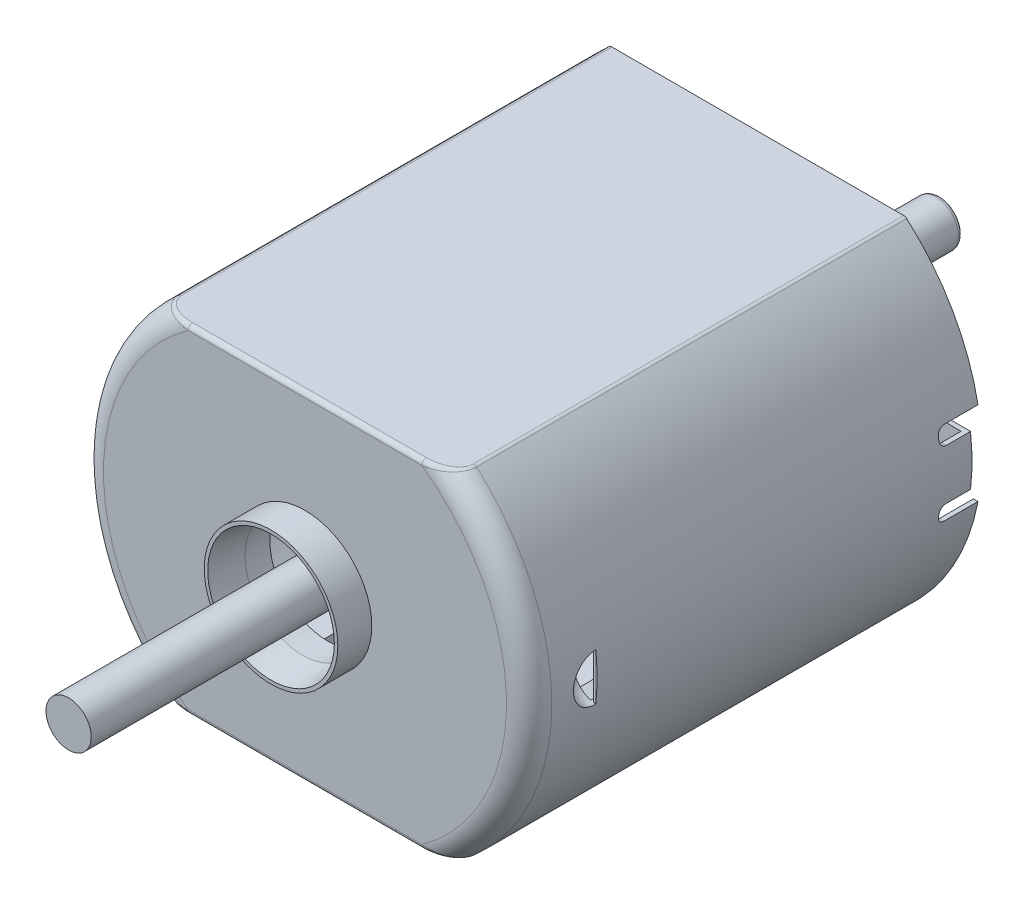
from build123d import *

# Parameters (mm, degrees)
BOSS_EXTRUDE1_DEPTH = 10
FILLET1_R           = 1
FILLET2_R           = 0.2
CUT_EXTRUDE1_DEPTH  = 3.5
BOSS_EXTRUDE2_DEPTH = 0.1
FILLET3_R           = 0.2
SKETCH4_R           = 2.95
SKETCH4_R_2         = 2.55
BOSS_EXTRUDE3_DEPTH = 1.5
CHAMFER1_SIZE       = 1.4
CHAMFER1_SIZE2      = 0.246857773
CUT_EXTRUDE2_DEPTH  = 11.75
CUT_EXTRUDE3_DEPTH  = 5.5
CUT_EXTRUDE4_DEPTH  = 13.5
CUT_EXTRUDE5_START  = -13.5
SKETCH8_R           = 2.55
CUT_EXTRUDE5_DEPTH  = 13.5
SKETCH10_W          = 12.644572441
SKETCH10_H          = 2.219087426
CUT_EXTRUDE6_DEPTH  = 9.625
CUT_REVOLVE1_ANGLE  = 180
CUT_REVOLVE2_ANGLE  = 180
SKETCH15_W          = 1.07108749
SKETCH15_H          = 2.219087426
CUT_EXTRUDE7_DEPTH  = 3.709331572
FILLET4_R           = 0.2
SKETCH16_R          = 1
BOSS_EXTRUDE4_DEPTH = 8.5
FILLET5_R           = 0.2
SKETCH17_R          = 1
BOSS_EXTRUDE5_DEPTH = 30


with BuildPart() as part:
    # Sketch1 → Boss-Extrude1 (new, symmetric)
    with BuildSketch(Plane.XY):
        with BuildLine():
            Line((-6.519777604, -7.45), (6.519777604, -7.45))
            ThreePointArc((6.519777604, -7.45), (9.9, 0), (6.519777604, 7.45))
            Line((6.519777604, 7.45), (-6.519777604, 7.45))
            ThreePointArc((-6.519777604, 7.45), (-9.9, 0), (-6.519777604, -7.45))
        make_face()
    extrude(amount=BOSS_EXTRUDE1_DEPTH, both=True)

    # Fillet1
    fillet1_edges = [part.edges().sort_by_distance(p)[0] for p in [
        (-9.9, 0, 10),
        (9.9, 0, 10),
    ]]
    fillet(fillet1_edges, radius=FILLET1_R)

    # Fillet2
    fillet2_edges = [part.edges().sort_by_distance(p)[0] for p in [
        (0, 7.45, 10),
        (0, -7.45, 10),
        (-6.519777604, 7.45, -0.5),
        (6.519777604, 7.45, -0.5),
        (-5.90343561, 7.45, 9.795904471),
        (5.90343561, 7.45, 9.795904471),
        (6.519777604, -7.45, -0.5),
        (-6.519777604, -7.45, -0.5),
        (-5.90343561, -7.45, 9.795904471),
        (5.90343561, -7.45, 9.795904471),
    ]]
    fillet(fillet2_edges, radius=FILLET2_R)

    # Sketch2 → Cut-Extrude1 (cut, symmetric)
    with BuildSketch(Plane.XY):
        Polygon((2.809004691, -7.45), (4.078019779, -6.905487171), (4.078019779, -6.588233399), (2.70413604, -7.177743586), (2.70413604, -5.101106343), (4.375445191, -5.101106343), (4.375445191, -7.316955751), (4.065378741, -7.45), align=None)
        Polygon((-4.375445191, -7.316955751), (-4.065378741, -7.45), (-2.809004691, -7.45), (-4.078019779, -6.905487171), (-4.078019779, -6.588233399), (-2.70413604, -7.177743586), (-2.70413604, -5.101106343), (-4.375445191, -5.101106343), align=None)
    extrude(amount=CUT_EXTRUDE1_DEPTH, both=True, mode=Mode.SUBTRACT)

    # Sketch3 → Boss-Extrude2 (add)
    with BuildSketch(Plane.XZ.offset(7.45)):
        Polygon((-4.375445191, -3.5), (-4.375445191, 0), (-3.437191716, -3.5), align=None)
        Polygon((3.437191716, -3.5), (4.375445191, 0), (4.375445191, -3.5), align=None)
    extrude(amount=-BOSS_EXTRUDE2_DEPTH)

    # Fillet3
    # the kernel refuses this fillet: 0.2 mm, written as the material it takes off along each edge
    with BuildSketch(Plane(origin=(3.325071696, -7.35, -3.918245264), x_dir=(0, -1, 0), z_dir=(0.2589300963584657, 0, 0.9658960633524685))) as fillet3_piece_1_section:
        with BuildLine():
            CenterArc((0.2, 0.173205081), FILLET3_R, 180, 60)
            Line((0, 0.173205081), (-0.004, 0.173205081))
            Line((-0.004, 0.173205081), (-0.004, 0))
            Line((-0.004, 0), (0, -0.004))
            ThreePointArc((0, -0.004), (0.05, -0.004), (0.098, -0.003464102))
            Line((0.098, -0.003464102), (0.1, 0))
        make_face()
    fillet3_piece_1 = extrude(amount=4.192182419, mode=Mode.PRIVATE)
    fillet3_piece_1 = split(fillet3_piece_1, bisect_by=Plane(origin=(3.476415364, -7.702714186, -3.918245264), z_dir=(-0.3943164502016401, 0.9189747205991999, 0)), keep=Keep.TOP, mode=Mode.PRIVATE)
    fillet3_piece_1 = split(fillet3_piece_1, bisect_by=Plane(origin=(3.325071696, -7.35, -3.5), z_dir=(0, 0, 1)), keep=Keep.TOP, mode=Mode.PRIVATE)
    add(fillet3_piece_1, mode=Mode.SUBTRACT)
    with BuildSketch(Plane(origin=(-4.410553893, -7.35, 0.130967231), x_dir=(0, -1, 0), z_dir=(0.2589300963584657, 0, -0.9658960633524685))) as fillet3_piece_2_section:
        with BuildLine():
            CenterArc((0.2, 0.173205081), FILLET3_R, 180, 60)
            Line((0, 0.173205081), (-0.004, 0.173205081))
            Line((-0.004, 0.173205081), (-0.004, 0))
            Line((-0.004, 0), (0, -0.004))
            ThreePointArc((0, -0.004), (0.05, -0.004), (0.098, -0.003464102))
            Line((0.098, -0.003464102), (0.1, 0))
        make_face()
    fillet3_piece_2 = extrude(amount=4.192182419, mode=Mode.PRIVATE)
    fillet3_piece_2 = split(fillet3_piece_2, bisect_by=Plane(origin=(-4.410553893, -7.35, -3.5), z_dir=(0, 0, 1)), keep=Keep.TOP, mode=Mode.PRIVATE)
    fillet3_piece_2 = split(fillet3_piece_2, bisect_by=Plane(origin=(-4.39312086, -7.309371421, 0.130967231), z_dir=(0.3943164502016401, 0.9189747205991999, 0)), keep=Keep.TOP, mode=Mode.PRIVATE)
    add(fillet3_piece_2, mode=Mode.SUBTRACT)

    # Sketch4 → Boss-Extrude3 (add)
    with BuildSketch(Plane.XY.offset(10)):
        Circle(SKETCH4_R)
        Circle(SKETCH4_R_2, mode=Mode.SUBTRACT)
    extrude(amount=BOSS_EXTRUDE3_DEPTH)

    # Chamfer1
    chamfer1_edges = [part.edges().sort_by_distance(p)[0] for p in [
        (-2.55, 0, 11.5),
    ]]
    chamfer1_side = [part.faces().sort_by_distance(p)[0] for p in [
        (-2.55, 0, 10.75),
    ]]
    chamfer(chamfer1_edges, length=CHAMFER1_SIZE, length2=CHAMFER1_SIZE2, reference=chamfer1_side[0])

    # Sketch5 → Cut-Extrude2 (cut, symmetric)
    with BuildSketch(Plane(origin=(0, 0, 0), x_dir=(0, 0, -1), z_dir=(1, 0, 0))):
        with BuildLine():
            Line((10, -1.85), (10, 1.85))
            Line((10, 1.85), (8.5, 1.85))
            ThreePointArc((8.5, 1.85), (8.287867966, 1.762132034), (8.2, 1.55))
            Line((8.2, 1.55), (8.2, 1.409543713))
            ThreePointArc((8.2, 1.409543713), (8.287867966, 1.197411679), (8.5, 1.109543713))
            Line((8.5, 1.109543713), (9.559222729, 1.109543713))
            Line((9.559222729, 1.109543713), (9.559222729, -1.109543713))
            Line((9.559222729, -1.109543713), (8.5, -1.109543713))
            ThreePointArc((8.5, -1.109543713), (8.287867966, -1.197411679), (8.2, -1.409543713))
            Line((8.2, -1.409543713), (8.2, -1.55))
            ThreePointArc((8.2, -1.55), (8.287867966, -1.762132034), (8.5, -1.85))
            Line((8.5, -1.85), (10, -1.85))
        make_face()
    extrude(amount=CUT_EXTRUDE2_DEPTH, both=True, mode=Mode.SUBTRACT)

    # Sketch6 → Cut-Extrude3 (cut)
    with BuildSketch(Plane(origin=(0, 0, -10), x_dir=(-1, 0, 0), z_dir=(0, 0, -1))):
        with BuildLine():
            Line((-6.444183424, -7.25), (6.444183424, -7.25))
            ThreePointArc((6.444183424, -7.25), (8.606512219, -4.474142088), (9.636332951, -1.109543713))
            Line((9.636332951, -1.109543713), (8.55391251, -1.109543713))
            Line((8.55391251, -1.109543713), (8.55391251, 1.109543713))
            Line((8.55391251, 1.109543713), (9.636332951, 1.109543713))
            ThreePointArc((9.636332951, 1.109543713), (8.606512219, 4.474142088), (6.444183424, 7.25))
            Line((6.444183424, 7.25), (-6.444183424, 7.25))
            ThreePointArc((-6.444183424, 7.25), (-8.606512219, 4.474142088), (-9.636332951, 1.109543713))
            Line((-9.636332951, 1.109543713), (-8.55391251, 1.109543713))
            Line((-8.55391251, 1.109543713), (-8.55391251, -1.109543713))
            Line((-8.55391251, -1.109543713), (-9.636332951, -1.109543713))
            ThreePointArc((-9.636332951, -1.109543713), (-8.606512219, -4.474142088), (-6.444183424, -7.25))
        make_face()
    extrude(amount=-CUT_EXTRUDE3_DEPTH, mode=Mode.SUBTRACT)

    # Sketch7 → Cut-Extrude4 (cut)
    with BuildSketch(Plane(origin=(0, 0, -4.5), x_dir=(-1, 0, 0), z_dir=(0, 0, -1))):
        with BuildLine():
            Line((2.70413604, -7.177743586), (2.70413604, -7.25))
            Line((2.70413604, -7.25), (-2.70413604, -7.25))
            Line((-2.70413604, -7.25), (-2.70413604, -7.177743586))
            Line((-2.70413604, -7.177743586), (-2.70413604, -5.101106343))
            Line((-2.70413604, -5.101106343), (-4.375445191, -5.101106343))
            Line((-4.375445191, -5.101106343), (-4.375445191, -7.25))
            Line((-4.375445191, -7.25), (-6.444183424, -7.25))
            ThreePointArc((-6.444183424, -7.25), (-8.606512219, -4.474142088), (-9.636332951, -1.109543713))
            Line((-9.636332951, -1.109543713), (-8.55391251, -1.109543713))
            Line((-8.55391251, -1.109543713), (-8.55391251, 1.109543713))
            Line((-8.55391251, 1.109543713), (-9.636332951, 1.109543713))
            ThreePointArc((-9.636332951, 1.109543713), (-8.606512219, 4.474142088), (-6.444183424, 7.25))
            Line((-6.444183424, 7.25), (6.444183424, 7.25))
            ThreePointArc((6.444183424, 7.25), (8.606512219, 4.474142088), (9.636332951, 1.109543713))
            Line((9.636332951, 1.109543713), (8.55391251, 1.109543713))
            Line((8.55391251, 1.109543713), (8.55391251, -1.109543713))
            Line((8.55391251, -1.109543713), (9.636332951, -1.109543713))
            ThreePointArc((9.636332951, -1.109543713), (8.606512219, -4.474142088), (6.444183424, -7.25))
            Line((6.444183424, -7.25), (4.375445191, -7.25))
            Line((4.375445191, -7.25), (4.375445191, -5.101106343))
            Line((4.375445191, -5.101106343), (2.70413604, -5.101106343))
            Line((2.70413604, -5.101106343), (2.70413604, -7.177743586))
        make_face()
    extrude(amount=-CUT_EXTRUDE4_DEPTH, mode=Mode.SUBTRACT)

    # Sketch8 → Cut-Extrude5 (cut)
    with BuildSketch(Plane.XY.offset(10).offset(CUT_EXTRUDE5_START)):
        with Locations(Location((0, 0, 0), (0, 0, 180))):
            Circle(SKETCH8_R)
    extrude(amount=CUT_EXTRUDE5_DEPTH, mode=Mode.SUBTRACT)

    # Sketch10 → Cut-Extrude6 (cut, symmetric)
    with BuildSketch(Plane(origin=(0, 0, 0), x_dir=(0, 0, -1), z_dir=(1, 0, 0))):
        with Locations((3.031617793, 0)):
            Rectangle(SKETCH10_W, SKETCH10_H)
    extrude(amount=CUT_EXTRUDE6_DEPTH, both=True, mode=Mode.SUBTRACT)

    # Sketch11 → Cut-Revolve1 (revolve, cut)
    with BuildSketch(Plane.XY.offset(7)):
        with BuildLine():
            Line((9.9, -1.040739178), (9.9, 1.040739178))
            ThreePointArc((9.9, 1.040739178), (8.859260822, 0), (9.9, -1.040739178))
        make_face()
    revolve(axis=Axis((9.9, -1.040739178, 7), (0, 1, 0)), revolution_arc=CUT_REVOLVE1_ANGLE, mode=Mode.SUBTRACT)

    # Sketch13 → Cut-Revolve2 (revolve, cut)
    with BuildSketch(Plane.XY.offset(7)):
        with BuildLine():
            Line((-9.9, -1.040739178), (-9.9, 1.040739178))
            ThreePointArc((-9.9, 1.040739178), (-8.859260822, 0), (-9.9, -1.040739178))
        make_face()
    revolve(axis=Axis((-9.9, -1.040739178, 7), (0, -1, 0)), revolution_arc=CUT_REVOLVE2_ANGLE, mode=Mode.SUBTRACT)

    # Sketch15 → Cut-Extrude7 (cut)
    with BuildSketch(Plane(origin=(0, 0, 3.290668428), x_dir=(-1, 0, 0), z_dir=(0, 0, -1))):
        with Locations((9.089456255, 0)):
            Rectangle(SKETCH15_W, SKETCH15_H)
        with Locations((-9.089456255, 0)):
            Rectangle(SKETCH15_W, SKETCH15_H)
    extrude(amount=-CUT_EXTRUDE7_DEPTH, mode=Mode.SUBTRACT)

    # Fillet4
    fillet4_edges = [part.edges().sort_by_distance(p)[0] for p in [
        (-9.625, 0, 7),
        (9.625, 0, 7),
    ]]
    fillet(fillet4_edges, radius=FILLET4_R)


with BuildPart() as body_2:
    # Sketch16 → Boss-Extrude4 (new body)
    with BuildSketch(Plane(origin=(0, 0, -9.559222729), x_dir=(-1, 0, 0), z_dir=(0, 0, -1))):
        Circle(SKETCH16_R)
    extrude(amount=BOSS_EXTRUDE4_DEPTH)

    # Fillet5
    fillet5_edges = [body_2.edges().sort_by_distance(p)[0] for p in [
        (1, 0, -18.059222729),
    ]]
    fillet(fillet5_edges, radius=FILLET5_R)

    # Sketch17 → Boss-Extrude5 (add)
    with BuildSketch(Plane.XY.offset(-9.559222729)):
        Circle(SKETCH17_R)
    extrude(amount=BOSS_EXTRUDE5_DEPTH)


solid = Compound([part.part, body_2.part])
